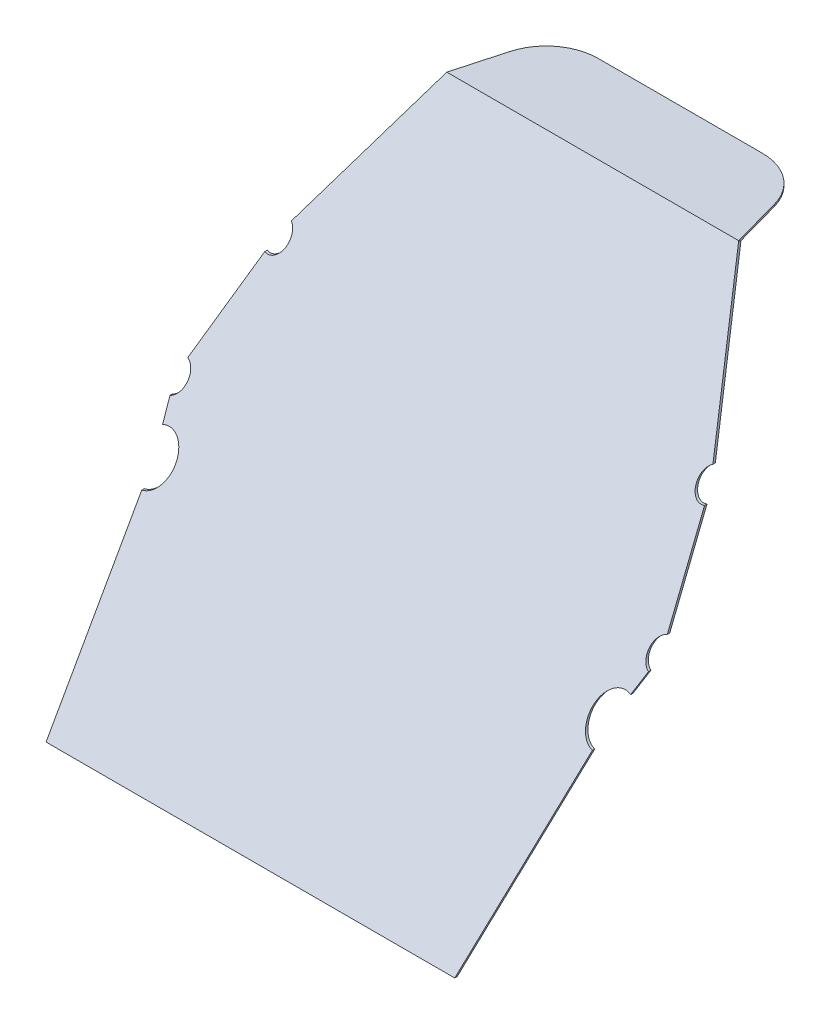
from build123d import *

# Parameters (mm, degrees)
BOSS_EXTRUDE1_DEPTH     = 2.54
SKETCH3_W               = 635
SKETCH3_H               = 1270
BOSS_EXTRUDE2_DEPTH     = 2.54
CUT_EXTRUDE1_DEPTH      = 1311.281906829
CUT_EXTRUDE1_DEPTH_BACK = 1311.281906829


with BuildPart() as part:
    # Sketch2 → Boss-Extrude1 (new body)
    with BuildSketch(Plane(origin=(0, 0, 0), x_dir=(1, 0, 0), z_dir=(0, 1, 0))):
        with BuildLine():
            Line((-190.5, 0), (190.5, 0))
            Line((190.5, 0), (172.589792707, 64.649970609))
            ThreePointArc((172.589792707, 64.649970609), (148.320865378, 100.476994518), (107.315, 114.3))
            Line((107.315, 114.3), (-107.315, 114.3))
            ThreePointArc((-107.315, 114.3), (-148.320865378, 100.476994518), (-172.589792707, 64.649970609))
            Line((-172.589792707, 64.649970609), (-190.5, 0))
        make_face()
    extrude(amount=-BOSS_EXTRUDE1_DEPTH)

    # Sketch3 → Boss-Extrude2 (add)
    with BuildSketch(Plane(origin=(0, 0, 0), x_dir=(1, 0, 0), z_dir=(0, 0.6156614753256567, 0.7880107536067232))):
        with Locations((0, -635)):
            Rectangle(SKETCH3_W, SKETCH3_H)
    extrude(amount=-BOSS_EXTRUDE2_DEPTH)

    # Sketch4 → Cut-Extrude1 (cut, two sides: drawn at the far end of the back side and taken through both)
    with BuildSketch(Plane.XY.offset(-CUT_EXTRUDE1_DEPTH_BACK)):
        with BuildLine():
            Line((-275.07291121, -151.325406705), (-190.5, 0))
            Line((-190.5, 0), (-571.5, 0))
            Line((-571.5, 0), (-571.5, -1524))
            Line((-571.5, -1524), (571.5, -1524))
            Line((571.5, -1524), (571.5, 0))
            Line((571.5, 0), (190.5, 0))
            Line((190.5, 0), (275.07291121, -151.325406705))
            ThreePointArc((275.07291121, -151.325406705), (268.12028899, -171.183230141), (286.984028398, -180.501569203))
            Line((286.984028398, -180.501569203), (312.982021819, -276.089162217))
            ThreePointArc((312.982021819, -276.089162217), (301.277723529, -291.035795076), (312.269080611, -306.514247899))
            Line((312.269080611, -306.514247899), (305.43807978, -327.663433526))
            ThreePointArc((305.43807978, -327.663433526), (272.877245274, -346.141774353), (294.096224924, -376.98674033))
            Line((294.096224924, -376.98674033), (266.7, -571.921009662))
            Line((266.7, -571.921009662), (-266.7, -571.921009662))
            Line((-266.7, -571.921009662), (-294.096224924, -376.98674033))
            ThreePointArc((-294.096224924, -376.98674033), (-272.877245274, -346.141774353), (-305.43807978, -327.663433526))
            Line((-305.43807978, -327.663433526), (-312.269080611, -306.514247899))
            ThreePointArc((-312.269080611, -306.514247899), (-301.277723529, -291.035795076), (-312.982021819, -276.089162217))
            Line((-312.982021819, -276.089162217), (-286.984028398, -180.501569203))
            ThreePointArc((-286.984028398, -180.501569203), (-268.12028899, -171.183230141), (-275.07291121, -151.325406705))
        make_face()
    extrude(amount=CUT_EXTRUDE1_DEPTH + CUT_EXTRUDE1_DEPTH_BACK, mode=Mode.SUBTRACT)


solid = part.part
